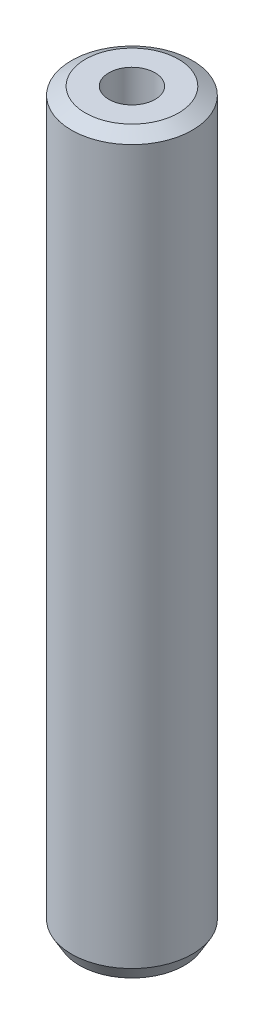
from build123d import *
from OCP.BRepFilletAPI import BRepFilletAPI_MakeChamfer

# Parameters (mm, degrees)
SKETCH1_R           = 12.5
BOSS_EXTRUDE1_DEPTH = 152.135248105
SKETCH2_R           = 4.780051734
CUT_EXTRUDE1_DEPTH  = 154.158851249
CHAMFER1_SIZE       = 1.652633747
CHAMFER1_SIZE2      = 2.862445616


with BuildPart() as part:
    # Sketch1 → Boss-Extrude1 (new body)
    with BuildSketch(Plane(origin=(0, 0, 0), x_dir=(1, 0, 0), z_dir=(0, 1, 0))):
        Circle(SKETCH1_R)
    extrude(amount=BOSS_EXTRUDE1_DEPTH)

    # Sketch2 → Cut-Extrude1 (cut, through all)
    with BuildSketch(Plane(origin=(0, 0, 0), x_dir=(1, 0, 0), z_dir=(0, 1, 0))):
        Circle(SKETCH2_R)
    extrude(amount=CUT_EXTRUDE1_DEPTH, mode=Mode.SUBTRACT)

    # Chamfer1: one chamfer whose edges measure the first distance from different faces: ONE call of the kernel's chamfer builder (chamfer() names one face for all edges)
    chamfer1_edges_1 = [part.edges().sort_by_distance(p)[0] for p in [
        (-12.5, 152.135248105, 0),
    ]]
    chamfer1_side_1 = [part.faces().sort_by_distance(p)[0] for p in [
        (-12.5, 76.067624053, 0),
    ]]
    chamfer1_edges_2 = [part.edges().sort_by_distance(p)[0] for p in [
        (-12.5, 0, 0),
    ]]
    chamfer1_side_2 = [part.faces().sort_by_distance(p)[0] for p in [
        (-12.146446609, 0, 0),
    ]]
    chamfer1 = BRepFilletAPI_MakeChamfer(part.part.solid().wrapped)
    for e in chamfer1_edges_1:
        chamfer1.Add(CHAMFER1_SIZE, CHAMFER1_SIZE2, e.wrapped, chamfer1_side_1[0].wrapped)  # the first distance lies on this face
    for e in chamfer1_edges_2:
        chamfer1.Add(CHAMFER1_SIZE, CHAMFER1_SIZE2, e.wrapped, chamfer1_side_2[0].wrapped)  # the first distance lies on this face
    add(Compound.cast(chamfer1.Shape()), mode=Mode.REPLACE)


solid = part.part
